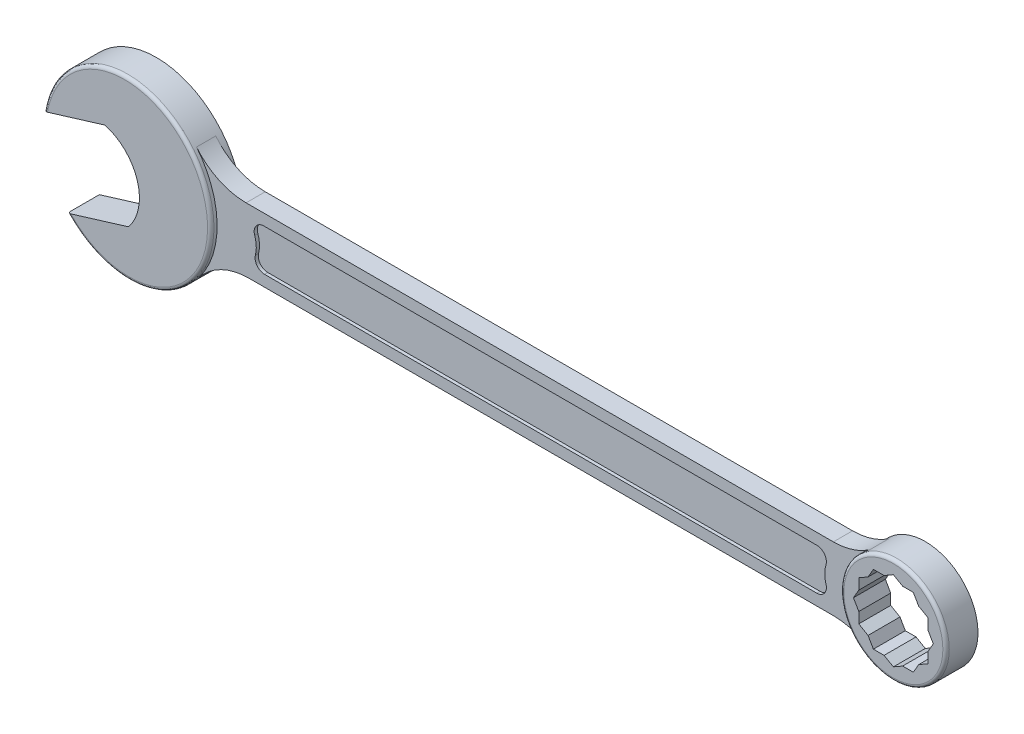
from build123d import *

# Parameters (mm, degrees)
BOSS_EXTRUDE1_DEPTH   = 5
SKETCH1_R             = 16.5
BOSS_EXTRUDE1_2_DEPTH = 5
BOSS_EXTRUDE2_DEPTH   = 3
FILLET1_R             = 20
FILLET2_R             = 20
CUT_EXTRUDE2_DEPTH    = 1
FILLET3_R             = 3
FILLET4_R             = 1


with BuildPart() as part:
    # Sketch1 → Boss-Extrude1 (new, symmetric)
    with BuildSketch(Plane.XY):
        with BuildLine():
            Line((-89.037246537, 5.145771556), (-69.911151418, 10.99320565))
            ThreePointArc((-69.911151418, 10.99320565), (-59.841193921, 1.000753662), (-62.6018588, -12.914413249))
            Line((-62.6018588, -12.914413249), (-81.727953919, -18.761847343))
            add(Edge.make_bspline(
                [(-81.727953919, -18.761847343), (-75.970192679, -24.96254562), (-66.036497368, -30.702161069), (-54.261890445, -29.791784887), (-45.594576586, -22.613996951), (-40.492485255, -14.62450022), (-39.892168067, -13.561182047), (-39.337840722, -12.433567655), (-38.839133597, -11.244623759), (-37.174223791, -6.471445922), (-36.459969738, -2.485639987), (-36.479263329, 1.794664805), (-37.363852998, 6.070136476), (-40.717584141, 14.389876918), (-43.371861692, 18.37840735), (-46.683351024, 21.510717566), (-50.182667946, 23.753288129), (-61.235413829, 28.5448765), (-72.434710747, 29.648831984), (-82.705378189, 23.819291411), (-87.731232608, 13.506082629), (-89.037246537, 5.145771556)],
                knots=[2.042658164, 2.042658164, 2.042658164, 2.042658164, 2.042658164, 2.042658164, 3.822478708, 3.822478708, 3.822478708, 3.822478708, 4.076668665, 4.076668665, 4.076668665, 4.076668665, 4.797306531, 4.797306531, 4.797306531, 4.797306531, 5.602299252, 5.602299252, 5.602299252, 5.602299252, 7.382119797, 7.382119797, 7.382119797, 7.382119797, 7.382119797, 7.382119797], degree=5, weights=[1, 1, 0.94508649, 0.94508649, 1, 1, 1.000011368, 1.000007947, 1, 1, 0.998684638, 0.998273166, 1, 1, 0.998540593, 0.999549465, 1, 1, 0.94508649, 0.94508649, 1, 1]))
        make_face()
    extrude(amount=BOSS_EXTRUDE1_DEPTH, both=True)



with BuildPart() as body_2:
    # Sketch1 → Boss-Extrude1 2 (new, symmetric)
    with BuildSketch(Plane.XY):
        with Locations((176.885488342, 0)):
            Circle(SKETCH1_R)
        Polygon((170.635488342, 10.825317547), (173.984853248, 10.825317547), (176.885488342, 12.5), (179.786123437, 10.825317547), (183.135488342, 10.825317547), (184.810170795, 7.924682453), (187.71080589, 6.25), (187.71080589, 2.900635095), (189.385488342, 0), (187.71080589, -2.900635095), (187.71080589, -6.25), (184.810170795, -7.924682453), (183.135488342, -10.825317547), (179.786123437, -10.825317547), (176.885488342, -12.5), (173.984853248, -10.825317547), (170.635488342, -10.825317547), (168.96080589, -7.924682453), (166.060170795, -6.25), (166.060170795, -2.900635095), (164.385488342, 0), (166.060170795, 2.900635095), (166.060170795, 6.25), (168.96080589, 7.924682453), align=None, mode=Mode.SUBTRACT)
    extrude(amount=BOSS_EXTRUDE1_2_DEPTH, both=True)


with BuildPart() as part_1:
    add(part.part)

    add(body_2.part)  # Boss-Extrude2 merges body 2
    # Sketch1<4> → Boss-Extrude2 (add, symmetric)
    with BuildSketch(Plane.XY):
        with BuildLine():
            Line((163.761083594, 10), (-38.94800166, 10))
            add(Edge.make_bspline(
                [(-38.405002213, -10), (-34.916949048, 0), (-38.94800166, 10)],
                knots=[4.076668665, 4.076668665, 4.076668665, 4.797306531, 4.797306531, 4.797306531], degree=2, weights=[0.909281691, 0.802112405, 0.816427746]))
            Line((-38.405002213, -10), (163.761083594, -10))
            ThreePointArc((163.761083594, -10), (160.385488342, 0), (163.761083594, 10))
        make_face()
    extrude(amount=BOSS_EXTRUDE2_DEPTH, both=True)

    # Fillet1
    fillet1_edges = [part_1.edges().sort_by_distance(p)[0] for p in [
        (-38.405002213, -10, 1.5),
        (-38.94800166, 10, -1.5),
    ]]
    fillet(fillet1_edges, radius=FILLET1_R)

    # Fillet2
    fillet2_edges = [part_1.edges().sort_by_distance(p)[0] for p in [
        (163.761083594, -10, 0),
        (163.761083594, 10, 0),
    ]]
    fillet(fillet2_edges, radius=FILLET2_R)

    # Sketch4 → Cut-Extrude2 (cut)
    with BuildSketch(Plane.XY.offset(3)):
        with BuildLine():
            Line((156.094865456, 6.5), (-27.783589266, 6.5))
            ThreePointArc((-27.783589266, 6.5), (-24.615419845, 0.197075053), (-26.832026734, -6.5))
            Line((-26.832026734, -6.5), (156.094865456, -6.5))
            ThreePointArc((156.094865456, -6.5), (153.402477301, 0), (156.094865456, 6.5))
        make_face()
    extrude(amount=-CUT_EXTRUDE2_DEPTH, mode=Mode.SUBTRACT)

    # Fillet3
    fillet3_edges = [part_1.edges().sort_by_distance(p)[0] for p in [
        (156.094865456, -6.5, 2.5),
        (156.094865456, 6.5, 2.5),
        (-26.832026734, -6.5, 2.5),
        (-27.783589266, 6.5, 2.5),
    ]]
    fillet(fillet3_edges, radius=FILLET3_R)

    # Fillet4
    fillet4_edges = [part_1.edges().sort_by_distance(p)[0] for p in [
        (160.385488342, 0, 5),
        (-38.114511658, 7.643267036, 5),
    ]]
    fillet(fillet4_edges, radius=FILLET4_R)


solid = part_1.part
